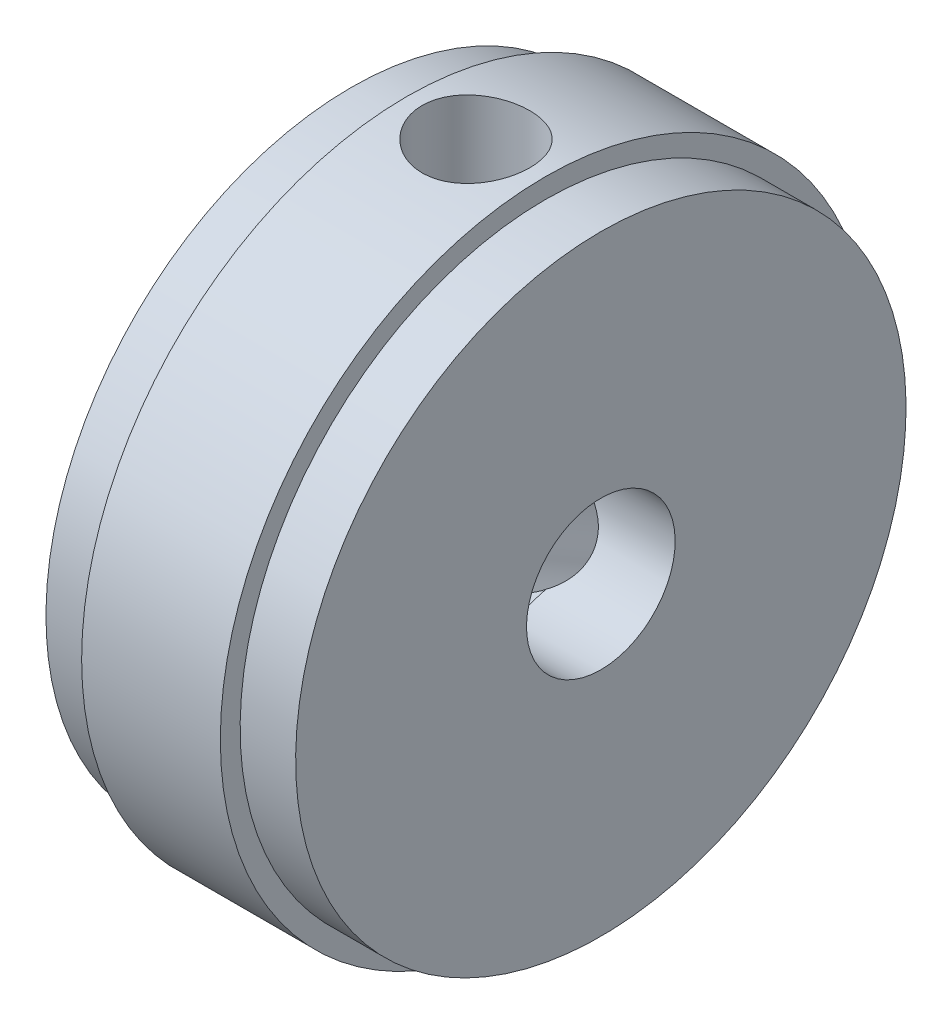
from build123d import *

# Parameters (mm, degrees)
SKETCH2_R          = 2.38125
CUT_EXTRUDE1_DEPTH = 17.760154892
CIRPATTERN1_COUNT  = 2
CIRPATTERN1_ANGLE  = 120


with BuildPart() as part:
    # Sketch1 → Revolve1 (revolve)
    with BuildSketch(Plane.XY):
        Polygon((4, 0), (-4, 0), (-4, 9.779), (-2.222, 9.779), (-2.222, 10.414), (2.222, 10.414), (2.222, 9.779), (4, 9.779), align=None)
    revolve(axis=Axis((8.430806561, 0, 0), (-1, 0, 0)))

    # Sketch2 → Cut-Extrude1 (cut, through all)
    with BuildSketch(Plane.ZY.offset(4)):
        Circle(SKETCH2_R)
    extrude(amount=-CUT_EXTRUDE1_DEPTH, mode=Mode.SUBTRACT)

    # Sketch4 → #8-32 Tapped Hole1 (revolve, cut)
    with BuildSketch(Plane(origin=(0, 10.414, 0), x_dir=(0, 0, 1), z_dir=(1, 0, 0))):
        Polygon((0, 0), (0, 13.483806461), (1.7272, 12.446), (1.7272, 0), align=None)
    f_8_32_tapped_hole1 = revolve(axis=Axis((0, 16.764, 0), (0, -1, 0)), mode=Mode.SUBTRACT)

    # CirPattern1: #8-32 Tapped Hole1 ×2 about axis
    cirpattern1_axis = Axis((4, 0, 0), (-1, 0, 0))
    for i in range(1, CIRPATTERN1_COUNT):
        add(f_8_32_tapped_hole1.rotate(cirpattern1_axis, i * CIRPATTERN1_ANGLE / (CIRPATTERN1_COUNT - 1)), mode=Mode.SUBTRACT)


solid = part.part
